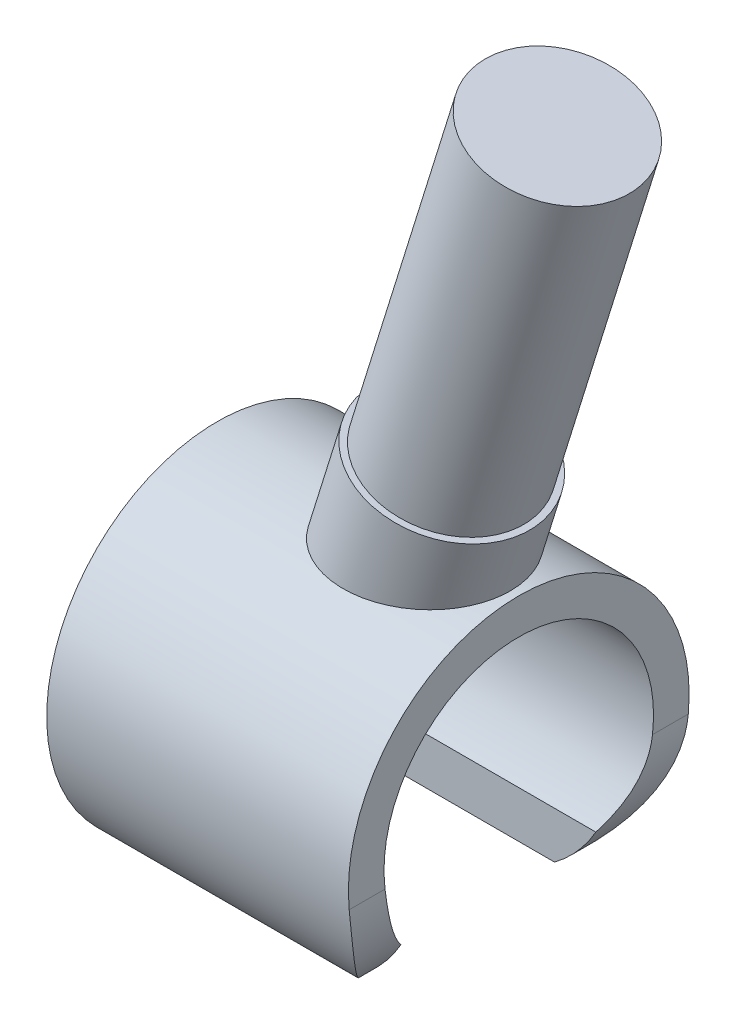
from build123d import *
from OCP.BRepAlgoAPI import BRepAlgoAPI_Cut
from OCP.TopTools import TopTools_ListOfShape

# Parameters (mm, degrees)
Y_KSEKLIK_EKSTR_ZYON1_DEPTH = 2.44
KES_EKSTR_ZYON3_DEPTH       = 10.057578549997631
KES_EKSTR_ZYON4_DEPTH       = 5.090004
KES_EKSTR_ZYON5_DEPTH       = 0.934494
KES_EKSTR_ZYON6_DEPTH       = 10.057578576936397
KES_EKSTR_ZYON8_REACH       = 10.265
KES_EKSTR_ZYON8_END_RADIUS  = 2.44
KES_EKSTR_ZYON9_REACH       = 10.265
KES_EKSTR_ZYON9_END_RADIUS  = 2.44


with BuildPart() as part:
    # Çizim1 → Yükseklik-Ekstrüzyon1 (new, symmetric)
    with BuildSketch(Plane.XY):
        with BuildLine():
            Line((1.7486491773698374, 0), (0, 0))
            Line((0, 0), (6e-16, -4.88))
            Line((6e-16, -4.88), (2.12, -4.88))
            ThreePointArc((2.12, -4.88), (3.675634918610405, -4.235634918610405), (4.32, -2.6799999999999997))
            Line((4.32, -2.6799999999999997), (4.32, 0))
            Line((4.32, 0), (4.199391645159483, 0))
            Line((4.199391645159483, -1.1e-16), (4.477130843400797, 0.8922663681456438))
            Line((4.477130843400797, 0.8922663681456439), (4.391197701600735, 0.9190151090575176))
            Line((4.391197701600735, 0.9190151090575169), (5.903988670353761, 5.779015109057521))
            Line((5.903988670353761, 5.779015109057521), (3.8415932671522843, 6.420984890942482))
            Line((3.8415932671522843, 6.420984890942482), (2.328802298399263, 1.5609848909424828))
            Line((2.328802298399263, 1.5609848909424828), (2.2428691565992014, 1.5877336318543567))
            Line((2.2428691565992014, 1.5877336318543567), (1.7486491773698374, -3.1e-16))
        make_face()
    extrude(amount=Y_KSEKLIK_EKSTR_ZYON1_DEPTH, both=True)

    # Çizim2 → Kes-Ekstrüzyon3 (cut, through all)
    with BuildSketch(Plane.ZY):
        with BuildLine():
            ThreePointArc((1.3949999999999998, -3.7737447281995147), (-1.7e-16, -0.5100000000000007), (-1.3950000000000002, -3.7737447281995147))
            Line((-1.395, -3.7737447281995147), (-1.395, -4.88))
            Line((-1.395, -4.88), (1.395, -4.88))
            Line((1.395, -4.88), (1.395, -3.7737447281995147))
        make_face()
    extrude(amount=-KES_EKSTR_ZYON3_DEPTH, mode=Mode.SUBTRACT)

    # Çizim4 → Kes-Ekstrüzyon4 (cut)
    with BuildSketch(Plane(origin=(2.161473909540523, 6.94396213181124, 0), x_dir=(0.9548126866673495, -0.2972082323541489, 0), z_dir=(0.2972082323541489, 0.9548126866673495, 0))):
        with BuildLine():
            Line((3.9196324190831633, 2.44), (1.7596324190831614, 2.44))
            Line((1.7596324190831614, 2.44), (1.7596324190831614, -7.8431217e-10))
            ThreePointArc((1.759632419083162, -7.8431216e-10), (2.8396324186910062, 1.0800000000000003), (3.919632419083163, 0))
            Line((3.9196324190831633, 0), (3.9196324190831633, 2.44))
        make_face()
        with BuildLine():
            ThreePointArc((3.919632419083163, -2.6e-16), (2.8396324194753184, -1.0800000000000003), (1.759632419083162, -7.8431216e-10))
            Line((1.7596324190831614, -7.8431217e-10), (1.7596324190831614, -2.44))
            Line((1.7596324190831614, -2.44), (3.9196324190831633, -2.44))
            Line((3.9196324190831633, -2.44), (3.9196324190831633, 0))
        make_face()
    extrude(amount=-KES_EKSTR_ZYON4_DEPTH, mode=Mode.SUBTRACT)

    # Çizim5 → Kes-Ekstrüzyon5 (cut)
    with BuildSketch(Plane(origin=(0.6486829407875186, 2.0839621318112433, 0), x_dir=(0.9548126866673489, -0.297208232354151, 0), z_dir=(0.297208232354151, 0.954812686667349, 0))):
        with BuildLine():
            Line((4.009632419083144, 2.44), (1.6696324190831455, 2.44))
            Line((1.6696324190831455, 2.44), (1.6696324190831455, -1.33146028e-09))
            ThreePointArc((1.6696324190831597, -1.33145976e-09), (2.83963241841743, 1.17), (4.009632419083159, 0))
            Line((4.009632419083145, 0), (4.009632419083144, 2.44))
        make_face()
        with BuildLine():
            ThreePointArc((4.009632419083159, -2.9e-16), (2.8396324197488894, -1.17), (1.6696324190831597, -1.33145976e-09))
            Line((1.6696324190831455, -1.33146028e-09), (1.6696324190831455, -2.44))
            Line((1.6696324190831455, -2.44), (4.009632419083145, -2.44))
            Line((4.009632419083145, -2.44), (4.009632419083145, 0))
        make_face()
    extrude(amount=-KES_EKSTR_ZYON5_DEPTH, mode=Mode.SUBTRACT)


with BuildPart() as kes_ekstr_zyon6_tool:
    # Çizim6 → Kes-Ekstrüzyon6 (new, through all)
    with BuildSketch(Plane.ZY):
        with BuildLine():
            Line((0, -2.1e-16), (-2.44, -2.1e-16))
            Line((-2.44, -2.1e-16), (-2.44, -2.4400000000003725))
            ThreePointArc((-2.44, -2.4399999999999995), (-1.7253405460951758, -0.7146594539048239), (1.5e-16, 0))
        make_face()
        with BuildLine():
            ThreePointArc((-1.3950000000000025, -4.441892854275672), (-2.1630302818037483, -3.569114697451059), (-2.44, -2.4399999999999995))
            Line((-2.44, -2.4400000000003725), (-2.44, -4.88))
            Line((-2.44, -4.88), (-1.395, -4.88))
            Line((-1.395, -4.88), (-1.395, -4.441892854275672))
        make_face()
        with BuildLine():
            Line((2.44, -2.1e-16), (0, -2.1e-16))
            ThreePointArc((1.5e-16, 0), (1.725340546095176, -0.7146594539048241), (2.44, -2.44))
            Line((2.44, -2.44), (2.44, -2.1e-16))
        make_face()
        with BuildLine():
            Line((2.44, -4.88), (2.44, -2.44))
            ThreePointArc((2.44, -2.4400000000000004), (2.163030281803748, -3.56911469745106), (1.3949999999999998, -4.441892854275673))
            Line((1.395, -4.441892854275672), (1.395, -4.88))
            Line((1.395, -4.88), (2.44, -4.88))
        make_face()
    extrude(amount=-KES_EKSTR_ZYON6_DEPTH)


with BuildPart() as part_1:
    add(part.part)

    # Kes-Ekstrüzyon6: cut by kes_ekstr_zyon6_tool, with a tolerance
    kes_ekstr_zyon6_stock = TopTools_ListOfShape()
    kes_ekstr_zyon6_stock.Append(part_1.part.wrapped)
    kes_ekstr_zyon6_tools = TopTools_ListOfShape()
    kes_ekstr_zyon6_tools.Append(kes_ekstr_zyon6_tool.part.wrapped)
    kes_ekstr_zyon6_cut = BRepAlgoAPI_Cut()
    kes_ekstr_zyon6_cut.SetArguments(kes_ekstr_zyon6_stock)
    kes_ekstr_zyon6_cut.SetTools(kes_ekstr_zyon6_tools)
    kes_ekstr_zyon6_cut.SetFuzzyValue(0.00001)
    kes_ekstr_zyon6_cut.Build()
    add(Compound.cast(kes_ekstr_zyon6_cut.Shape()).solids(), mode=Mode.REPLACE)


with BuildPart() as kes_ekstr_zyon6_piece_1:
    # of the separate pieces the step leaves, piece 1, a body of its own (kes_ekstr_zyon6_pieces)
    add(part_1.part.solids().sort_by_distance((1.965129847, 0.695466905, -2.44))[0])

    # Kes-Ekstrüzyon8: up to this cylinder (the profile starts outside it)
    kes_ekstr_zyon8_end = Plane(origin=(3.0822610000000004, -2.4399999999999995, 0), z_dir=(-1, -1.2e-16, 0)) * Cylinder(KES_EKSTR_ZYON8_END_RADIUS, 26.41, mode=Mode.PRIVATE)
    # Çizim8 → Kes-Ekstrüzyon8 (cut, up to the surface)
    with BuildSketch(Plane(origin=(0.37094363090195914, 1.191695404996726, 3e-17), x_dir=(0.9548126866673489, -0.297208232354151, 0), z_dir=(0.297208232354151, 0.954812686667349, 0)), mode=Mode.PRIVATE) as kes_ekstr_zyon8_sk1:
        with BuildLine():
            Line((1.6696324190831446, 2.44), (1.6696324190831482, 6e-17))
            ThreePointArc((1.6696324190831482, 2e-16), (2.839632419083148, 1.17), (4.0096324190831485, 6e-17))
            Line((4.0096324190831485, 0), (4.009632419083145, 2.44))
            Line((4.009632419083145, 2.44), (1.6696324190831446, 2.44))
        make_face()
    kes_ekstr_zyon8_tool1 = extrude(kes_ekstr_zyon8_sk1.sketch, amount=-KES_EKSTR_ZYON8_REACH, mode=Mode.PRIVATE) - kes_ekstr_zyon8_end
    add(kes_ekstr_zyon8_tool1.solids().sort_by_distance((3.082261, 0.347733, -1.657042))[0], mode=Mode.SUBTRACT)

    # Kes-Ekstrüzyon9: up to this cylinder (the profile starts outside it)
    kes_ekstr_zyon9_end = Plane(origin=(3.0822600000000007, -2.4399999999999995, 0), z_dir=(-1, -1.2e-16, 0)) * Cylinder(KES_EKSTR_ZYON9_END_RADIUS, 26.41, mode=Mode.PRIVATE)
    # Çizim9 → Kes-Ekstrüzyon9 (cut, up to the surface)
    with BuildSketch(Plane(origin=(0.37094363090195914, 1.191695404996726, 3e-17), x_dir=(0.9548126866673489, -0.297208232354151, 0), z_dir=(0.297208232354151, 0.954812686667349, 0)), mode=Mode.PRIVATE) as kes_ekstr_zyon9_sk1:
        with BuildLine():
            ThreePointArc((4.0096324190831485, -1.1e-16), (2.839632419083148, -1.1699999999999997), (1.6696324190831482, 3.2e-16))
            Line((1.6696324190831482, 1.8e-16), (1.669632419083145, -2.44))
            Line((1.669632419083145, -2.44), (4.0096312122899445, -2.44))
            Line((4.0096312122899445, -2.44), (4.0096324190831485, 0))
        make_face()
    kes_ekstr_zyon9_tool1 = extrude(kes_ekstr_zyon9_sk1.sketch, amount=-KES_EKSTR_ZYON9_REACH, mode=Mode.PRIVATE) - kes_ekstr_zyon9_end
    add(kes_ekstr_zyon9_tool1.solids().sort_by_distance((3.08226, 0.347733, 1.657042))[0], mode=Mode.SUBTRACT)


with BuildPart() as kes_ekstr_zyon6_piece_2:
    # of the separate pieces the step leaves, piece 2, a body of its own (kes_ekstr_zyon6_pieces)
    add(part_1.part.solids().sort_by_distance((0, 0, 0))[0])


solid = Compound([kes_ekstr_zyon6_piece_1.part, kes_ekstr_zyon6_piece_2.part])
